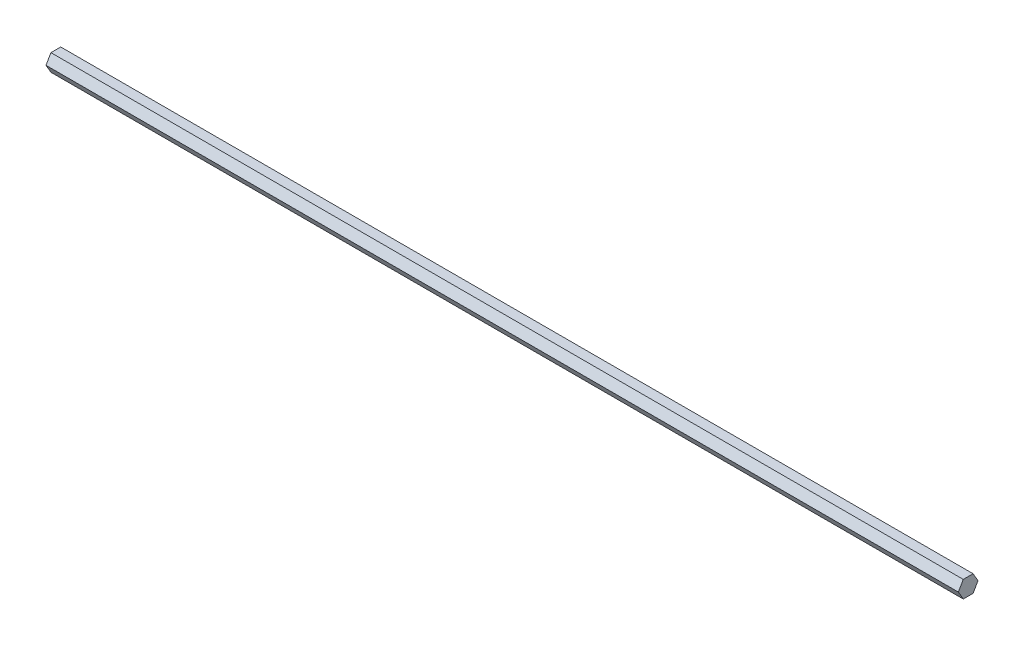
from build123d import *

# Parameters (mm, degrees)
BOSS_EXTRUDE1_DEPTH = 680.847


with BuildPart() as part:
    # Sketch1 → Boss-Extrude1 (new body)
    with BuildSketch(Plane(origin=(0, 0, 0), x_dir=(0, 0, -1), z_dir=(1, 0, 0))):
        Polygon((7.332348419, 0), (3.666174209, 6.35), (-3.666174209, 6.35), (-7.332348419, 0), (-3.666174209, -6.35), (3.666174209, -6.35), align=None)
    extrude(amount=BOSS_EXTRUDE1_DEPTH)


solid = part.part
